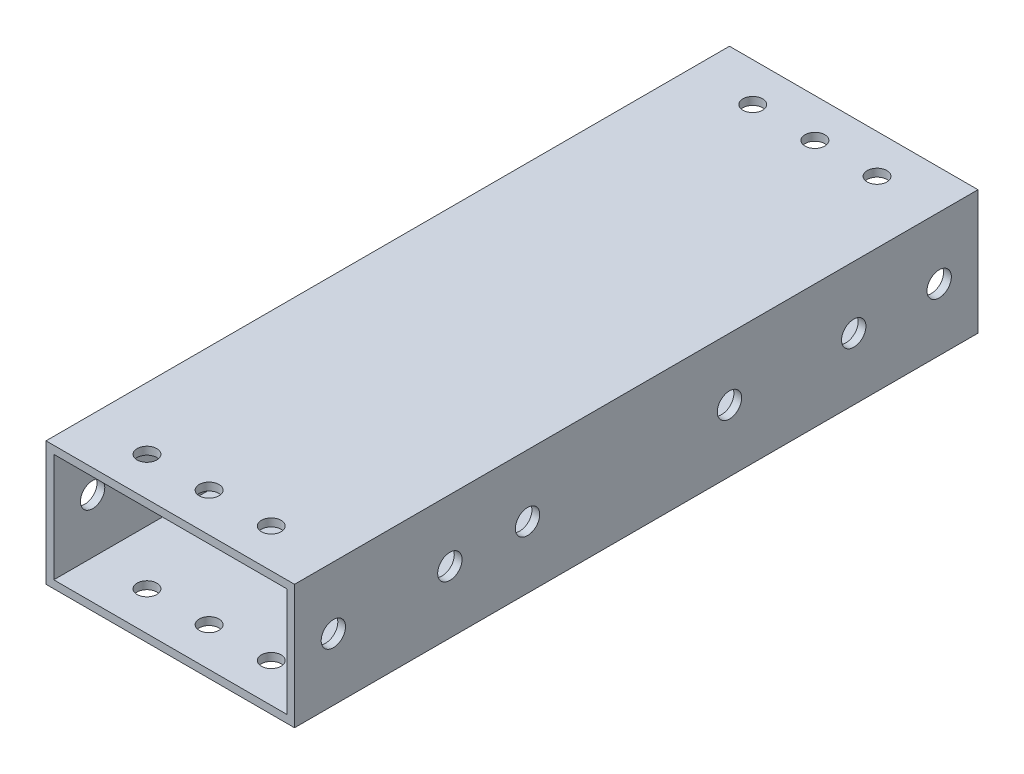
from build123d import *

# Parameters (mm, degrees)
SKETCH1_W           = 50.8
SKETCH1_H           = 25.4
SKETCH1_W_2         = 47.625
SKETCH1_H_2         = 22.225
BOSS_EXTRUDE1_DEPTH = 69.85
SKETCH2_R           = 2.0193
CUT_EXTRUDE1_DEPTH  = 79.545162168
SKETCH3_R           = 2.4892
CUT_EXTRUDE2_DEPTH  = 88.298066989


with BuildPart() as part:
    # Sketch1 → Boss-Extrude1 (new, symmetric)
    with BuildSketch(Plane.XY):
        Rectangle(SKETCH1_W, SKETCH1_H)
        Rectangle(SKETCH1_W_2, SKETCH1_H_2, mode=Mode.SUBTRACT)
    extrude(amount=BOSS_EXTRUDE1_DEPTH, both=True)

    # Sketch2 → Cut-Extrude1 (cut, through all)
    with BuildSketch(Plane(origin=(0, 12.7, 0), x_dir=(1, 0, 0), z_dir=(0, 1, 0))):
        with Locations((-12.7, 61.9125)):
            Circle(SKETCH2_R)
        with Locations((0, 61.9125)):
            Circle(SKETCH2_R)
        with Locations((12.7, 61.9125)):
            Circle(SKETCH2_R)
        with Locations((12.7, -61.9125)):
            Circle(SKETCH2_R)
        with Locations((0, -61.9125)):
            Circle(SKETCH2_R)
        with Locations((-12.7, -61.9125)):
            Circle(SKETCH2_R)
    extrude(amount=-CUT_EXTRUDE1_DEPTH, mode=Mode.SUBTRACT)

    # Sketch3 → Cut-Extrude2 (cut, through all)
    with BuildSketch(Plane(origin=(25.4, 0, 0), x_dir=(0, 0, -1), z_dir=(1, 0, 0))):
        with Locations((61.9125, 0)):
            Circle(SKETCH3_R)
        with Locations((44.45, 0)):
            Circle(SKETCH3_R)
        with Locations((19.05, 0)):
            Circle(SKETCH3_R)
        with Locations((-61.9125, 0)):
            Circle(SKETCH3_R)
        with Locations((-38.1, 0)):
            Circle(SKETCH3_R)
        with Locations((-22.225, 0)):
            Circle(SKETCH3_R)
    extrude(amount=-CUT_EXTRUDE2_DEPTH, mode=Mode.SUBTRACT)


solid = part.part
